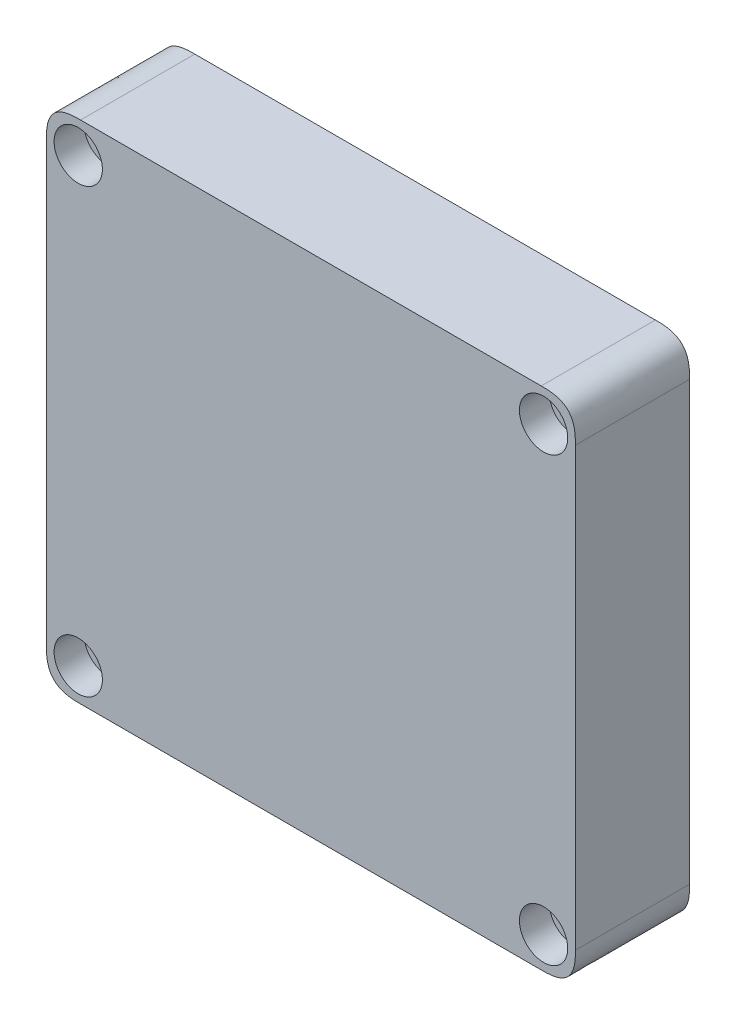
from build123d import *

# Parameters (mm, degrees)
SKETCH2_R           = 1.5
BOSS_EXTRUDE1_DEPTH = 10.35
BOSS_EXTRUDE2_START = 10.35
SKETCH2_3_R         = 1.5
BOSS_EXTRUDE2_DEPTH = 3
FILLET1_SIZE        = 4
FILLET2_SIZE        = 4
SKETCH7_R           = 2.825
CUT_EXTRUDE1_DEPTH  = 3.5


with BuildPart() as part:
    # Sketch2 → Boss-Extrude1 (new body)
    with BuildSketch(Plane.XY):
        Polygon((-30.92, -35), (-23.9, -35), (-23.9, 18.9), (23.9, 18.9), (23.9, -35), (30.92, -35), (30.92, 24.12), (-30.92, 24.12), align=None)
        with Locations((-27.2, -31.28)):
            Circle(SKETCH2_R, mode=Mode.SUBTRACT)
        with Locations((27.2, -31.28)):
            Circle(SKETCH2_R, mode=Mode.SUBTRACT)
        with Locations((-27.2, 20.4)):
            Circle(SKETCH2_R, mode=Mode.SUBTRACT)
        with Locations((27.2, 20.4)):
            Circle(SKETCH2_R, mode=Mode.SUBTRACT)
    extrude(amount=BOSS_EXTRUDE1_DEPTH)

    # Sketch2<3> → Boss-Extrude2 (add)
    # profile 1 of 2: a face of its own
    with BuildSketch(Plane.XY.offset(BOSS_EXTRUDE2_START)):
        Polygon((-30.92, -35), (-23.9, -35), (-23.9, 18.9), (23.9, 18.9), (23.9, -35), (30.92, -35), (30.92, 24.12), (-30.92, 24.12), align=None)
        with Locations((-27.2, -31.28)):
            Circle(SKETCH2_3_R, mode=Mode.SUBTRACT)
        with Locations((27.2, -31.28)):
            Circle(SKETCH2_3_R, mode=Mode.SUBTRACT)
        with Locations((-27.2, 20.4)):
            Circle(SKETCH2_3_R, mode=Mode.SUBTRACT)
        with Locations((27.2, 20.4)):
            Circle(SKETCH2_3_R, mode=Mode.SUBTRACT)
    # profile 2 of 2: a face of its own
    with BuildSketch(Plane.XY.offset(BOSS_EXTRUDE2_START)):
        Polygon((-23.9, -35), (-16, -35), (16, -35), (23.9, -35), (23.9, 18.9), (-23.9, 18.9), align=None)
    extrude(amount=BOSS_EXTRUDE2_DEPTH)

    # Fillet1
    # a fillet whose section is not a circle: 4 mm, written as the material it adds along each edge
    with BuildSketch(Plane(origin=(-23.9, 18.9, 0), x_dir=(0, -1, 0), z_dir=(0, 0, 1))) as fillet1_piece_1_section:
        with BuildLine():
            add(Edge.make_bspline([(FILLET1_SIZE, 0), (FILLET1_SIZE * 0.831801948466, 0), (FILLET1_SIZE * 0.663603896932, 0), (FILLET1_SIZE * 0.292893218813, FILLET1_SIZE * 0.0716919198361), (FILLET1_SIZE * 0.0716919198361, FILLET1_SIZE * 0.292893218813), (0, FILLET1_SIZE * 0.663603896932), (0, FILLET1_SIZE * 0.831801948466), (0, FILLET1_SIZE)], knots=[0, 0, 0, 0, 0, 0, 0.5, 0.5, 1, 1, 1, 1, 1, 1], degree=5))
            Line((0, FILLET1_SIZE), (0, 0))
            Line((0, 0), (FILLET1_SIZE, 0))
        make_face()
    fillet1_piece_1 = extrude(amount=20.35, mode=Mode.PRIVATE)
    fillet1_piece_1 = split(fillet1_piece_1, bisect_by=Plane(origin=(-23.9, 18.9, 13.35), z_dir=(0, 0, -1)), keep=Keep.TOP, mode=Mode.PRIVATE)
    add(fillet1_piece_1)
    with BuildSketch(Plane(origin=(23.9, 18.9, 0), x_dir=(-1, 0, 0), z_dir=(0, 0, 1))) as fillet1_piece_2_section:
        with BuildLine():
            add(Edge.make_bspline([(FILLET1_SIZE, 0), (FILLET1_SIZE * 0.831801948466, 0), (FILLET1_SIZE * 0.663603896932, 0), (FILLET1_SIZE * 0.292893218813, FILLET1_SIZE * 0.0716919198361), (FILLET1_SIZE * 0.0716919198361, FILLET1_SIZE * 0.292893218813), (0, FILLET1_SIZE * 0.663603896932), (0, FILLET1_SIZE * 0.831801948466), (0, FILLET1_SIZE)], knots=[0, 0, 0, 0, 0, 0, 0.5, 0.5, 1, 1, 1, 1, 1, 1], degree=5))
            Line((0, FILLET1_SIZE), (0, 0))
            Line((0, 0), (FILLET1_SIZE, 0))
        make_face()
    fillet1_piece_2 = extrude(amount=20.35, mode=Mode.PRIVATE)
    fillet1_piece_2 = split(fillet1_piece_2, bisect_by=Plane(origin=(23.9, 18.9, 13.35), z_dir=(0, 0, -1)), keep=Keep.TOP, mode=Mode.PRIVATE)
    add(fillet1_piece_2)

    # Fillet2
    # a fillet whose section is not a circle: 4 mm, written as the material it takes off along each edge
    with BuildSketch(Plane(origin=(23.9, -35, -10), x_dir=(0, 1, 0), z_dir=(0, 0, 1)), Plane(origin=(-23.9, -35, -10), x_dir=(-1, 0, 0), z_dir=(0, 0, 1))) as fillet2_piece_1:
        with BuildLine():
            add(Edge.make_bspline([(FILLET2_SIZE, 0), (FILLET2_SIZE * 0.831801948466, 0), (FILLET2_SIZE * 0.663603896932, 0), (FILLET2_SIZE * 0.292893218813, -FILLET2_SIZE * 0.0716919198361), (FILLET2_SIZE * 0.0716919198361, -FILLET2_SIZE * 0.292893218813), (0, -FILLET2_SIZE * 0.663603896932), (0, -FILLET2_SIZE * 0.831801948466), (0, -FILLET2_SIZE)], knots=[0, 0, 0, 0, 0, 0, 0.5, 0.5, 1, 1, 1, 1, 1, 1], degree=5))
            Line((0, -FILLET2_SIZE), (0, 0))
            Line((0, 0), (FILLET2_SIZE, 0))
        make_face()
    extrude(amount=20.35, mode=Mode.SUBTRACT)
    with BuildSketch(Plane(origin=(-30.92, -35, 23.35), x_dir=(1, 0, 0), z_dir=(0, 0, -1)), Plane(origin=(30.92, -35, -10), x_dir=(-1, 0, 0), z_dir=(0, 0, 1))) as fillet2_piece_2:
        with BuildLine():
            add(Edge.make_bspline([(FILLET2_SIZE, 0), (FILLET2_SIZE * 0.831801948466, 0), (FILLET2_SIZE * 0.663603896932, 0), (FILLET2_SIZE * 0.292893218813, -FILLET2_SIZE * 0.0716919198361), (FILLET2_SIZE * 0.0716919198361, -FILLET2_SIZE * 0.292893218813), (0, -FILLET2_SIZE * 0.663603896932), (0, -FILLET2_SIZE * 0.831801948466), (0, -FILLET2_SIZE)], knots=[0, 0, 0, 0, 0, 0, 0.5, 0.5, 1, 1, 1, 1, 1, 1], degree=5))
            Line((0, -FILLET2_SIZE), (0, 0))
            Line((0, 0), (FILLET2_SIZE, 0))
        make_face()
    extrude(amount=33.35, mode=Mode.SUBTRACT)
    with BuildSketch(Plane(origin=(30.92, 24.12, 23.35), x_dir=(0, -1, 0), z_dir=(0, 0, -1)), Plane(origin=(-30.92, 24.12, 23.35), x_dir=(1, 0, 0), z_dir=(0, 0, -1))) as fillet2_piece_3:
        with BuildLine():
            add(Edge.make_bspline([(FILLET2_SIZE, 0), (FILLET2_SIZE * 0.831801948466, 0), (FILLET2_SIZE * 0.663603896932, 0), (FILLET2_SIZE * 0.292893218813, FILLET2_SIZE * 0.0716919198361), (FILLET2_SIZE * 0.0716919198361, FILLET2_SIZE * 0.292893218813), (0, FILLET2_SIZE * 0.663603896932), (0, FILLET2_SIZE * 0.831801948466), (0, FILLET2_SIZE)], knots=[0, 0, 0, 0, 0, 0, 0.5, 0.5, 1, 1, 1, 1, 1, 1], degree=5))
            Line((0, FILLET2_SIZE), (0, 0))
            Line((0, 0), (FILLET2_SIZE, 0))
        make_face()
    extrude(amount=33.35, mode=Mode.SUBTRACT)

    # Sketch7 → Cut-Extrude1 (cut)
    with BuildSketch(Plane.XY.offset(13.35)):
        with Locations((-27.2, 20.4)):
            Circle(SKETCH7_R)
        with Locations((27.2, 20.4)):
            Circle(SKETCH7_R)
        with Locations((27.2, -31.28)):
            Circle(SKETCH7_R)
        with Locations((-27.2, -31.28)):
            Circle(SKETCH7_R)
    extrude(amount=-CUT_EXTRUDE1_DEPTH, mode=Mode.SUBTRACT)


solid = part.part
